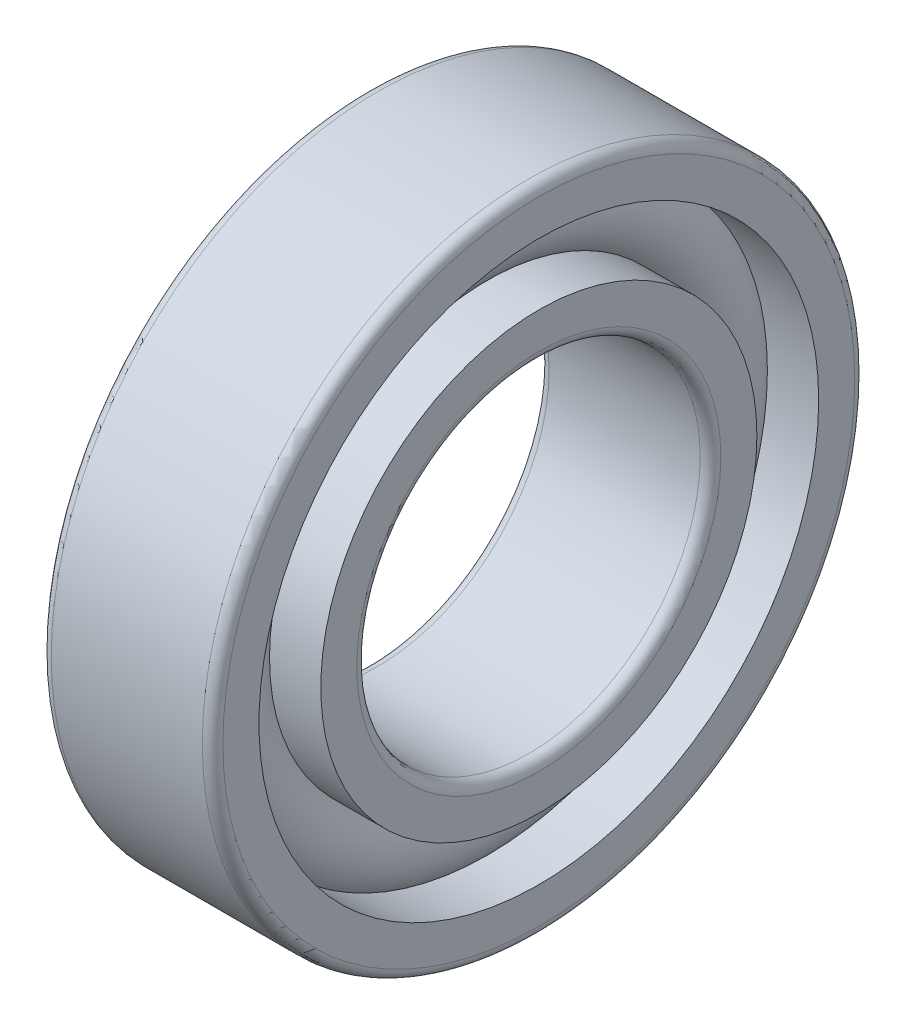
from build123d import *

# Parameters (mm, degrees)
CAGSPISKE_W     = 0.27
CAGSPISKE_H     = 0.45
CAGESPINE_ANGLE = 0.001
BALSIMSKE_R     = 1.35


with BuildPart() as part:
    # CagSpiSke → CageSpine (revolve)
    with BuildSketch(Plane.XY):
        with Locations((0, 7.25)):
            Rectangle(CAGSPISKE_W, CAGSPISKE_H)
    revolve(axis=Axis((-20.6375, 0, 0), (-1, 0, 0)), revolution_arc=CAGESPINE_ANGLE)

    # BalSimSke → BallsSimplified (revolve)
    with BuildSketch(Plane.XY):
        with Locations((0, 7.25)):
            Circle(BALSIMSKE_R)
    revolve(axis=Axis((-10, 0, 0), (1, 0, 0)))

    # InnRacSke → InnerRace (revolve)
    with BuildSketch(Plane.XY):
        with BuildLine():
            Line((-0.972432517, 6.35), (-2.5, 6.35))
            Line((-2.5, 6.35), (-2.5, 5.3))
            ThreePointArc((-2.5, 5.3), (-2.412132034, 5.087867966), (-2.2, 5))
            Line((-2.2, 5), (2.2, 5))
            ThreePointArc((2.2, 5), (2.412132034, 5.087867966), (2.5, 5.3))
            Line((2.5, 5.3), (2.5, 6.35))
            Line((2.5, 6.35), (0.972432517, 6.35))
            ThreePointArc((0.972432517, 6.35), (0, 5.925), (-0.972432517, 6.35))
        make_face()
    revolve(axis=Axis((-20.6375, 0, 0), (1, 0, 0)))

    # OutRacSke → OuterRace (revolve)
    with BuildSketch(Plane.XY):
        with BuildLine():
            Line((-0.972432517, 8.15), (-2.5, 8.15))
            Line((-2.5, 8.15), (-2.5, 9.2))
            ThreePointArc((-2.5, 9.2), (-2.412132034, 9.412132034), (-2.2, 9.5))
            Line((-2.2, 9.5), (2.2, 9.5))
            ThreePointArc((2.2, 9.5), (2.412132034, 9.412132034), (2.5, 9.2))
            Line((2.5, 9.2), (2.5, 8.15))
            Line((2.5, 8.15), (0.972432517, 8.15))
            ThreePointArc((0.972432517, 8.15), (0, 8.575), (-0.972432517, 8.15))
        make_face()
    revolve(axis=Axis((-20.6375, 0, 0), (1, 0, 0)))


solid = part.part
